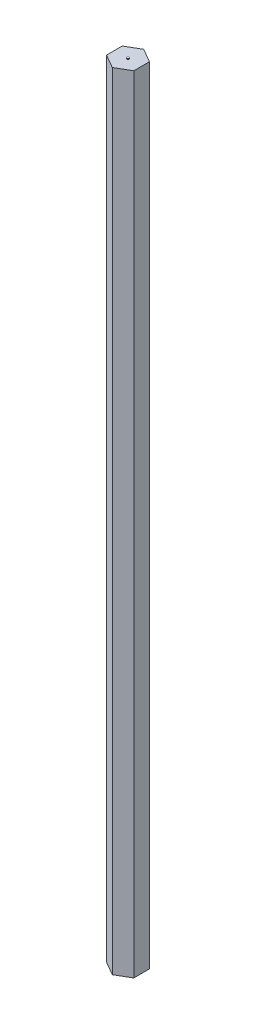
from build123d import *

# Parameters (mm, degrees)
BOSS_EXTRUDE1_DEPTH = 100000
SKETCH2_R           = 150
BOSS_EXTRUDE2_DEPTH = 100


with BuildPart() as part:
    # Sketch1 → Boss-Extrude1 (new body)
    with BuildSketch(Plane(origin=(0, 0, 0), x_dir=(1, 0, 0), z_dir=(0, 1, 0))):
        Polygon((1732.050807569, -1000), (1732.050807569, 1000), (0, 2000), (-1732.050807569, 1000), (-1732.050807569, -1000), (0, -2000), align=None)
    extrude(amount=BOSS_EXTRUDE1_DEPTH)

    # Sketch2 → Boss-Extrude2 (add)
    with BuildSketch(Plane(origin=(0, 100000, 0), x_dir=(1, 0, 0), z_dir=(0, 1, 0))):
        Circle(SKETCH2_R)
    extrude(amount=BOSS_EXTRUDE2_DEPTH)


solid = part.part
